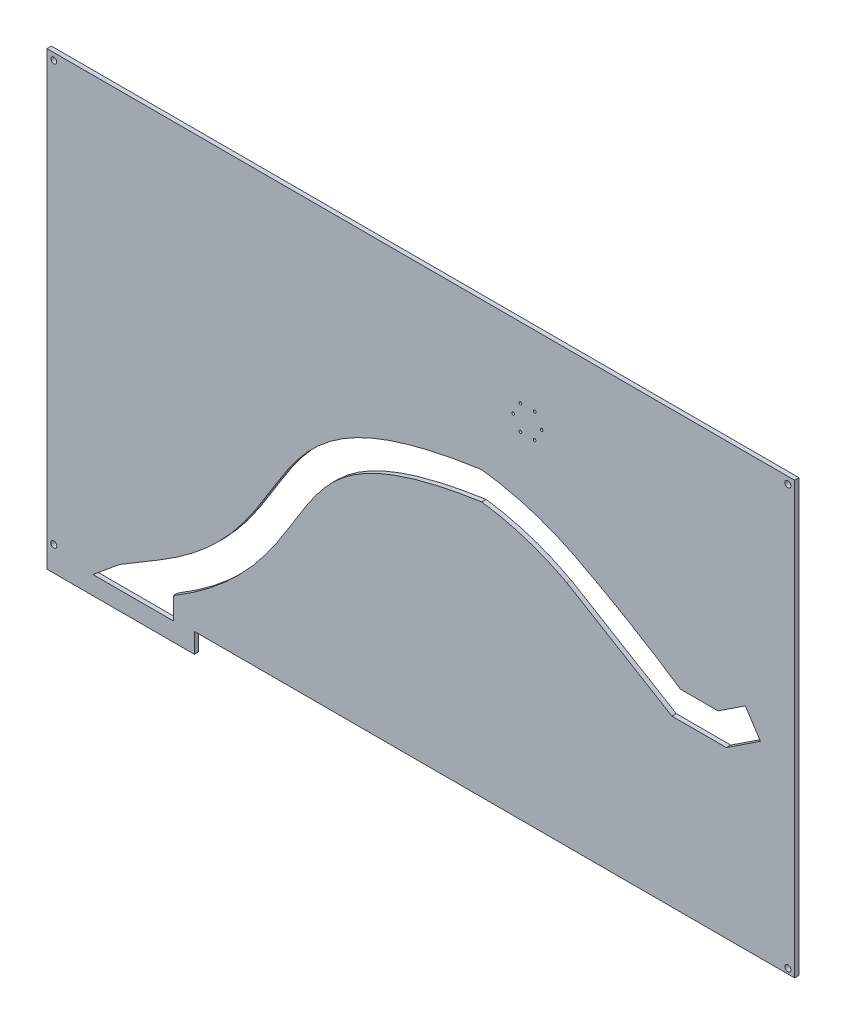
from build123d import *

# Parameters (mm, degrees)
SKETCH1_R           = 3.292374312
SKETCH1_R_2         = 3.294421934
SKETCH1_R_3         = 3.163533699
SKETCH1_R_4         = 1.5
BOSS_EXTRUDE1_DEPTH = 4.7625


with BuildPart() as part:
    # Sketch1 → Boss-Extrude1 (new body)
    with BuildSketch(Plane.XY):
        Polygon((-436.816755826, -147.994392447), (215.080766979, -147.994392447), (215.080766979, 320), (-596.816755826, 320), (-596.816755826, -150), (-596.816755826, -169.55039994), (-436.816755826, -169.55039994), align=None)
        with Locations((-589.375723826, -142.5578)):
            Circle(SKETCH1_R, mode=Mode.SUBTRACT)
        with Locations((207.642212326, -142.5578)):
            Circle(SKETCH1_R, mode=Mode.SUBTRACT)
        with Locations((207.642212326, 312.5578)):
            Circle(SKETCH1_R_2, mode=Mode.SUBTRACT)
        with Locations((-589.375723826, 312.5578)):
            Circle(SKETCH1_R_3, mode=Mode.SUBTRACT)
        with Locations((-90.5, 230)):
            Circle(SKETCH1_R_4, mode=Mode.SUBTRACT)
        with Locations((-82.75, 243.423393759)):
            Circle(SKETCH1_R_4, mode=Mode.SUBTRACT)
        with Locations((-67.25, 243.423393759)):
            Circle(SKETCH1_R_4, mode=Mode.SUBTRACT)
        with Locations((-59.5, 230)):
            Circle(SKETCH1_R_4, mode=Mode.SUBTRACT)
        with Locations((-67.25, 216.576606241)):
            Circle(SKETCH1_R_4, mode=Mode.SUBTRACT)
        with Locations((-82.75, 216.576606241)):
            Circle(SKETCH1_R_4, mode=Mode.SUBTRACT)
        with BuildLine():
            Line((-475, -100), (-518.031074044, -125.74437106))
            Line((-518.031074044, -125.74437106), (-546.780363752, -149.55039994))
            Line((-546.780363752, -149.55039994), (-459.597813184, -149.55039994))
            Line((-459.597813184, -149.55039994), (-459.597813184, -125.74437106))
            add(Edge.make_bspline(
                [(-459.597813184, -125.74437106), (-458.129207209, -124.865742348), (-455.185829054, -123.081513508), (-449.471359557, -119.524654219), (-442.555549408, -115.046151368), (-434.636214281, -109.639746192), (-424.556425744, -102.386073958), (-412.829398694, -93.24529863), (-400.055778993, -82.1905419), (-388.486450966, -71.092190732), (-374.537420018, -56.304576734), (-359.620141336, -37.979207276), (-344.890774823, -16.767556206), (-332.340078528, 3.245699555), (-321.055163892, 21.796443272), (-310.225956981, 38.664819129), (-299.079604806, 53.834809894), (-286.812791685, 67.514642691), (-272.431751915, 80.088460877), (-257.652665703, 89.924055398), (-243.498210685, 97.442015492), (-231.565093385, 102.886615769), (-218.172694067, 108.112662921), (-203.190999217, 113.087836875), (-189.281720356, 116.996077726), (-177.243425929, 119.962936855), (-167.745823902, 122.104113686), (-157.766000623, 124.157339904), (-149.036898589, 125.791853127), (-141.799270328, 127.051772068), (-136.243143266, 127.972296195), (-131.502167372, 128.719120718), (-127.648712651, 129.303231945), (-125.690331117, 129.592450023), (-124.714693771, 129.734664734)],
                knots=[0, 0, 0, 0, 0.00777259, 0.01554518, 0.03109036, 0.04663554, 0.062180721, 0.093271081, 0.124361441, 0.155451801, 0.186542162, 0.248722882, 0.310903603, 0.373084323, 0.435265044, 0.497445764, 0.559626485, 0.621807206, 0.683987926, 0.746168647, 0.777259007, 0.808349367, 0.839439728, 0.870530088, 0.901620448, 0.917165628, 0.932710808, 0.948255989, 0.963801169, 0.971573759, 0.979346349, 0.987118939, 0.991005234, 0.994891529, 0.994891529, 0.994891529, 0.994891529], degree=3))
            ThreePointArc((-124.714693771, 129.734664734), (-77.172123272, 119.052933104), (-32.323699215, 100))
            Line((-32.323699215, 100), (81.77450832, 31.56416045))
            Line((81.77450832, 31.56416045), (140.88780849, 31.56416045))
            Line((140.88780849, 31.56416045), (177.923308763, 55.973921994))
            Line((177.923308763, 55.973921994), (161.413907899, 81.022668132))
            Line((161.413907899, 81.022668132), (131.890654865, 61.56416045))
            Line((131.890654865, 61.56416045), (90.97120992, 61.56416045))
            ThreePointArc((90.97120992, 61.56416045), (35.57180112, 96.520479224), (-21.701372103, 128.313911667))
            Line((-21.701372103, 128.313911667), (-25, 130))
            ThreePointArc((-25, 130), (-73.684930832, 149.383563894), (-125, 160))
            add(Edge.make_bspline(
                [(-475, -100), (-419.540575809, -66.820070684), (-329.590802121, 43.11603253), (-307.635554762, 134.287094016), (-125, 160)],
                knots=[0, 0, 0, 0, 0.312223899, 1, 1, 1, 1], degree=3))
        make_face(mode=Mode.SUBTRACT)
    extrude(amount=BOSS_EXTRUDE1_DEPTH)


solid = part.part
